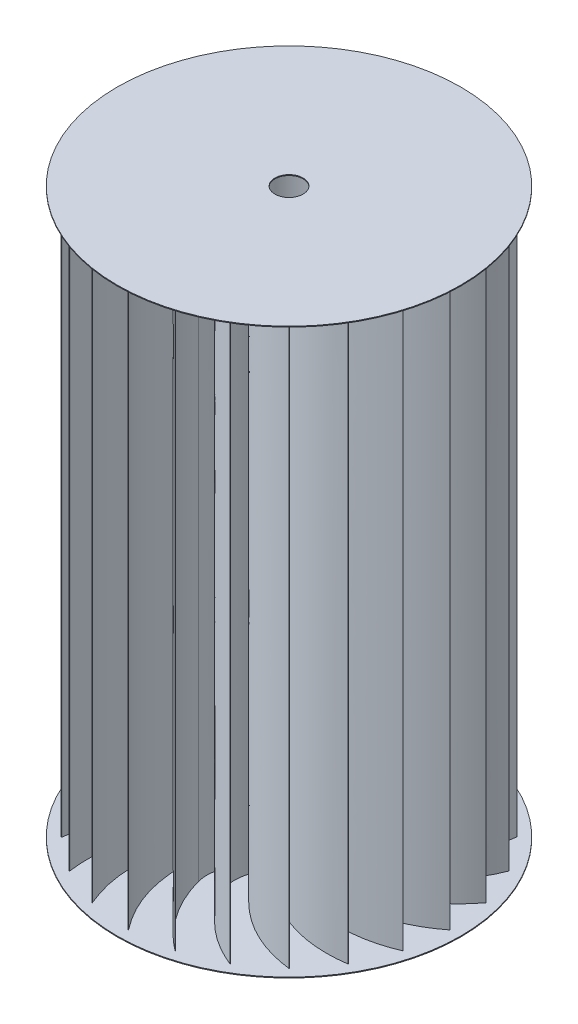
from build123d import *
from build123d.topology import SkipClean

# Parameters (mm, degrees)
SKETCH2_R           = 150
SKETCH2_R_2         = 147
BOSS_EXTRUDE1_DEPTH = 2000
BOSS_EXTRUDE2_DEPTH = 2000
BOSS_EXTRUDE3_DEPTH = 2000
CIRPATTERN3_COUNT   = 24
SKETCH4_R           = 610
SKETCH4_R_2         = 147
BOSS_EXTRUDE4_DEPTH = 3
SKETCH5_R           = 610
SKETCH5_R_2         = 147
BOSS_EXTRUDE5_DEPTH = 3
SKETCH6_R           = 147
SKETCH6_R_2         = 130
BOSS_EXTRUDE6_DEPTH = 2006
SKETCH7_R           = 130
SKETCH7_R_2         = 50
BOSS_EXTRUDE7_DEPTH = 3
SKETCH8_R           = 130
SKETCH8_R_2         = 50
BOSS_EXTRUDE8_DEPTH = 3


with BuildPart() as part:
    # Sketch2 → Boss-Extrude1 (new body)
    with BuildSketch(Plane(origin=(0, 0, 0), x_dir=(1, 0, 0), z_dir=(0, 1, 0))):
        with Locations(Location((572.26, 0, 0), (0, 0, 270))):
            Circle(SKETCH2_R)
        with Locations(Location((572.26, 0, 0), (0, 0, 270))):
            Circle(SKETCH2_R_2, mode=Mode.SUBTRACT)
    extrude(amount=BOSS_EXTRUDE1_DEPTH)



with BuildPart() as body_2:
    # Sketch1 → Boss-Extrude2 (new body)
    with BuildSketch(Plane(origin=(0, 0, 0), x_dir=(1, 0, 0), z_dir=(0, 1, 0))):
        with BuildLine():
            Line((0, 0), (0.929302303, -1.177453706))
            Line((0.929302303, -1.177453706), (2.108099405, -0.249856061))
            add(Edge.make_bspline(
                [(2.108099405, -0.249856061), (4.866724603, 1.914449951), (10.446113414, 6.200399481), (21.635427535, 14.433937002), (35.776077815, 24.173589538), (52.950690829, 34.965674488), (76.123351506, 48.186695467), (105.573189007, 62.549739562), (141.615202568, 76.426124664), (178.286268961, 87.0429343), (215.510709623, 94.499646646), (246.938290598, 98.162475841), (272.270957434, 99.611259771), (285.022996015, 99.85), (291.39, 99.85)],
                knots=[0.004413847, 0.004413847, 0.004413847, 0.004413847, 0.035525914, 0.066637981, 0.128862116, 0.19108625, 0.253310385, 0.377758654, 0.502206923, 0.626655193, 0.751103462, 0.875551731, 0.937775865, 1, 1, 1, 1], degree=3))
            add(Edge.make_bspline(
                [(291.39, 99.85), (292.790797468, 99.85), (295.611518889, 99.809400981), (301.096487329, 99.570498896), (307.768523814, 98.984958416), (315.451537828, 97.851230448), (325.283015371, 95.801899225), (336.805878229, 92.301279814), (349.447672512, 86.8179583), (360.940185272, 80.270449704), (374.777251883, 70.412737483), (386.450303937, 59.301042433), (396.083800465, 47.81853518), (402.319689093, 39.24394543), (407.597165043, 30.929849049), (411.947159653, 23.100425964), (414.825143631, 17.167401838), (416.694749279, 12.889698099), (417.884408753, 9.944451943), (418.865057779, 7.292571325), (419.640991347, 4.961145288), (420.117560122, 3.323476353), (420.403273404, 2.191726264), (420.50606366, 1.730956285), (420.556142767, 1.486082847)],
                knots=[0, 0, 0, 0, 0.014890509, 0.029781019, 0.059562037, 0.089343056, 0.119124075, 0.178686112, 0.238248149, 0.297810186, 0.357372224, 0.476496298, 0.536058335, 0.595620373, 0.65518241, 0.714744447, 0.774306485, 0.804087503, 0.833868522, 0.86364954, 0.893430559, 0.923211578, 0.938102087, 0.952992596, 0.952992596, 0.952992596, 0.952992596], degree=3))
            Line((420.556142767, 1.486082847), (420.76, 0))
            Line((420.76, 0), (422.26, 0))
            add(Edge.make_bspline(
                [(291.39, 101.35), (387.328159702, 101.35), (422.26, 8.868385288), (422.26, 0)],
                knots=[0, 0, 0, 0, 1, 1, 1, 1], degree=3))
            add(Edge.make_bspline(
                [(0, 0), (89.235934923, 70.429231609), (188.552504352, 101.35), (291.39, 101.35)],
                knots=[0, 0, 0, 0, 1, 1, 1, 1], degree=3))
        make_face()
    extrude(amount=BOSS_EXTRUDE2_DEPTH)


with BuildPart() as part_1:
    add(part.part)

    add(body_2.part)  # Boss-Extrude3 merges body 2
    # Sketch3 → Boss-Extrude3 (add)
    with BuildSketch(Plane(origin=(0, 2000, 0), x_dir=(1, 0, 0), z_dir=(0, 1, 0))):
        with BuildLine():
            Line((424.696623157, -8.014514271), (423.909477685, 0))
            Line((423.909477685, 0), (420.76, 0))
            add(Edge.make_bspline(
                [(420.76, 0), (421.366756211, -4.423144484), (424.696623157, -8.014514271)],
                knots=[0, 0, 0, 1, 1, 1], degree=2))
        make_face()
    extrude(amount=-BOSS_EXTRUDE3_DEPTH)


with BuildPart() as cirpattern3_1:
    # CirPattern3: pattern copy
    add(part_1.part.rotate(Axis((572.26, 2000, 0), (0, -1, 0)), 1 * 360 / CIRPATTERN3_COUNT))


with BuildPart() as cirpattern3_2:
    # CirPattern3: pattern copy
    add(part_1.part.rotate(Axis((572.26, 2000, 0), (0, -1, 0)), 2 * 360 / CIRPATTERN3_COUNT))


with BuildPart() as cirpattern3_3:
    # CirPattern3: pattern copy
    add(part_1.part.rotate(Axis((572.26, 2000, 0), (0, -1, 0)), 3 * 360 / CIRPATTERN3_COUNT))


with BuildPart() as cirpattern3_4:
    # CirPattern3: pattern copy
    add(part_1.part.rotate(Axis((572.26, 2000, 0), (0, -1, 0)), 4 * 360 / CIRPATTERN3_COUNT))


with BuildPart() as cirpattern3_5:
    # CirPattern3: pattern copy
    add(part_1.part.rotate(Axis((572.26, 2000, 0), (0, -1, 0)), 5 * 360 / CIRPATTERN3_COUNT))


with BuildPart() as cirpattern3_6:
    # CirPattern3: pattern copy
    add(part_1.part.rotate(Axis((572.26, 2000, 0), (0, -1, 0)), 6 * 360 / CIRPATTERN3_COUNT))


with BuildPart() as cirpattern3_7:
    # CirPattern3: pattern copy
    add(part_1.part.rotate(Axis((572.26, 2000, 0), (0, -1, 0)), 7 * 360 / CIRPATTERN3_COUNT))


with BuildPart() as cirpattern3_8:
    # CirPattern3: pattern copy
    add(part_1.part.rotate(Axis((572.26, 2000, 0), (0, -1, 0)), 8 * 360 / CIRPATTERN3_COUNT))


with BuildPart() as cirpattern3_9:
    # CirPattern3: pattern copy
    add(part_1.part.rotate(Axis((572.26, 2000, 0), (0, -1, 0)), 9 * 360 / CIRPATTERN3_COUNT))


with BuildPart() as cirpattern3_10:
    # CirPattern3: pattern copy
    add(part_1.part.rotate(Axis((572.26, 2000, 0), (0, -1, 0)), 10 * 360 / CIRPATTERN3_COUNT))


with BuildPart() as cirpattern3_11:
    # CirPattern3: pattern copy
    add(part_1.part.rotate(Axis((572.26, 2000, 0), (0, -1, 0)), 11 * 360 / CIRPATTERN3_COUNT))


with BuildPart() as cirpattern3_12:
    # CirPattern3: pattern copy
    add(part_1.part.rotate(Axis((572.26, 2000, 0), (0, -1, 0)), 12 * 360 / CIRPATTERN3_COUNT))


with BuildPart() as cirpattern3_13:
    # CirPattern3: pattern copy
    add(part_1.part.rotate(Axis((572.26, 2000, 0), (0, -1, 0)), 13 * 360 / CIRPATTERN3_COUNT))


with BuildPart() as cirpattern3_14:
    # CirPattern3: pattern copy
    add(part_1.part.rotate(Axis((572.26, 2000, 0), (0, -1, 0)), 14 * 360 / CIRPATTERN3_COUNT))


with BuildPart() as cirpattern3_15:
    # CirPattern3: pattern copy
    add(part_1.part.rotate(Axis((572.26, 2000, 0), (0, -1, 0)), 15 * 360 / CIRPATTERN3_COUNT))


with BuildPart() as cirpattern3_16:
    # CirPattern3: pattern copy
    add(part_1.part.rotate(Axis((572.26, 2000, 0), (0, -1, 0)), 16 * 360 / CIRPATTERN3_COUNT))


with BuildPart() as cirpattern3_17:
    # CirPattern3: pattern copy
    add(part_1.part.rotate(Axis((572.26, 2000, 0), (0, -1, 0)), 17 * 360 / CIRPATTERN3_COUNT))


with BuildPart() as cirpattern3_18:
    # CirPattern3: pattern copy
    add(part_1.part.rotate(Axis((572.26, 2000, 0), (0, -1, 0)), 18 * 360 / CIRPATTERN3_COUNT))


with BuildPart() as cirpattern3_19:
    # CirPattern3: pattern copy
    add(part_1.part.rotate(Axis((572.26, 2000, 0), (0, -1, 0)), 19 * 360 / CIRPATTERN3_COUNT))


with BuildPart() as cirpattern3_20:
    # CirPattern3: pattern copy
    add(part_1.part.rotate(Axis((572.26, 2000, 0), (0, -1, 0)), 20 * 360 / CIRPATTERN3_COUNT))


with BuildPart() as cirpattern3_21:
    # CirPattern3: pattern copy
    add(part_1.part.rotate(Axis((572.26, 2000, 0), (0, -1, 0)), 21 * 360 / CIRPATTERN3_COUNT))


with BuildPart() as cirpattern3_22:
    # CirPattern3: pattern copy
    add(part_1.part.rotate(Axis((572.26, 2000, 0), (0, -1, 0)), 22 * 360 / CIRPATTERN3_COUNT))


with BuildPart() as cirpattern3_23:
    # CirPattern3: pattern copy
    add(part_1.part.rotate(Axis((572.26, 2000, 0), (0, -1, 0)), 23 * 360 / CIRPATTERN3_COUNT))


with BuildPart() as cirpattern3_1_1:
    add(cirpattern3_1.part)

    # Combine1: union part, CirPattern3_2, CirPattern3_3, CirPattern3_4, CirPattern3_5, CirPattern3_6, CirPattern3_7, CirPattern3_8, CirPattern3_9, CirPattern3_11, CirPattern3_10, CirPattern3_12, CirPattern3_13, CirPattern3_14, CirPattern3_15, CirPattern3_16, CirPattern3_17, CirPattern3_18, CirPattern3_19, CirPattern3_20, CirPattern3_21, CirPattern3_22, CirPattern3_23
    add(part_1.part)
    add(cirpattern3_2.part)
    add(cirpattern3_3.part)
    add(cirpattern3_4.part)
    add(cirpattern3_5.part)
    add(cirpattern3_6.part)
    add(cirpattern3_7.part)
    add(cirpattern3_8.part)
    add(cirpattern3_9.part)
    add(cirpattern3_11.part)
    add(cirpattern3_10.part)
    add(cirpattern3_12.part)
    add(cirpattern3_13.part)
    add(cirpattern3_14.part)
    add(cirpattern3_15.part)
    add(cirpattern3_16.part)
    add(cirpattern3_17.part)
    add(cirpattern3_18.part)
    add(cirpattern3_19.part)
    add(cirpattern3_20.part)
    add(cirpattern3_21.part)
    add(cirpattern3_22.part)
    add(cirpattern3_23.part)

    # Sketch4 → Boss-Extrude4 (add)
    with BuildSketch(Plane(origin=(0, 2000, 0), x_dir=(1, 0, 0), z_dir=(0, 1, 0))):
        with Locations(Location((572.26, 0, 0), (0, 0, 270))):
            Circle(SKETCH4_R)
        with Locations(Location((572.26, 0, 0), (0, 0, 270))):
            Circle(SKETCH4_R_2, mode=Mode.SUBTRACT)
    extrude(amount=BOSS_EXTRUDE4_DEPTH)

    # Sketch5 → Boss-Extrude5 (add)
    with SkipClean():  # the faces are left unmerged after this step: merging them gives an invalid solid
        with BuildSketch(Plane.XZ):
            with Locations(Location((572.26, 0, 0), (0, 0, 90))):
                Circle(SKETCH5_R)
            with Locations(Location((572.26, 0, 0), (0, 0, 270))):
                Circle(SKETCH5_R_2, mode=Mode.SUBTRACT)
        extrude(amount=BOSS_EXTRUDE5_DEPTH)

    # Sketch6 → Boss-Extrude6 (add)
    with BuildSketch(Plane(origin=(0, 2003, 0), x_dir=(1, 0, 0), z_dir=(0, 1, 0))):
        with Locations((572.26, 0)):
            Circle(SKETCH6_R)
        with Locations(Location((572.26, 0, 0), (0, 0, 270))):
            Circle(SKETCH6_R_2, mode=Mode.SUBTRACT)
    extrude(amount=-BOSS_EXTRUDE6_DEPTH)

    # Sketch7 → Boss-Extrude7 (add)
    with BuildSketch(Plane(origin=(0, 2003, 0), x_dir=(1, 0, 0), z_dir=(0, 1, 0))):
        with Locations(Location((572.26, 0, 0), (0, 0, 270))):
            Circle(SKETCH7_R)
        with Locations(Location((572.26, 0, 0), (0, 0, 270))):
            Circle(SKETCH7_R_2, mode=Mode.SUBTRACT)
    extrude(amount=-BOSS_EXTRUDE7_DEPTH)

    # Sketch8 → Boss-Extrude8 (add)
    with BuildSketch(Plane.XZ.offset(3)):
        with Locations(Location((572.26, 0, 0), (0, 0, 90))):
            Circle(SKETCH8_R)
        with Locations(Location((572.26, 0, 0), (0, 0, 90))):
            Circle(SKETCH8_R_2, mode=Mode.SUBTRACT)
    extrude(amount=-BOSS_EXTRUDE8_DEPTH)


solid = cirpattern3_1_1.part
